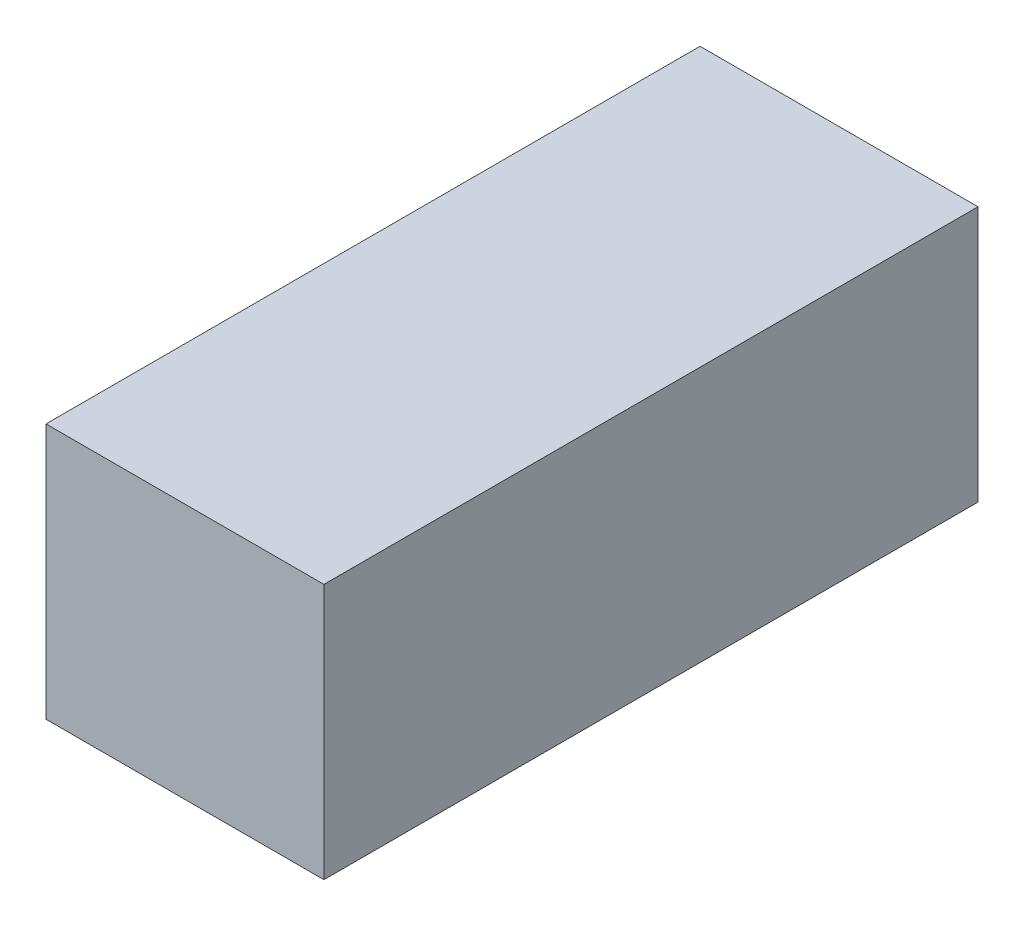
from build123d import *

# Parameters (mm, degrees)
ESTRUSIONE_ESTRUSIONE1_DEPTH      = 413
ESTRUSIONE_ESTRUSIONE1_DEPTH_BACK = 413
SCHIZZO1_W                        = 351
SCHIZZO1_H                        = 323


with BuildPart() as part:
    # Schizzo1 → Estrusione-Estrusione1 (new, two sides: drawn at the far end of the back side and taken through both)
    with BuildSketch(Plane.XY.offset(-ESTRUSIONE_ESTRUSIONE1_DEPTH_BACK)):
        Rectangle(SCHIZZO1_W, SCHIZZO1_H)
    extrude(amount=ESTRUSIONE_ESTRUSIONE1_DEPTH + ESTRUSIONE_ESTRUSIONE1_DEPTH_BACK)


solid = part.part
